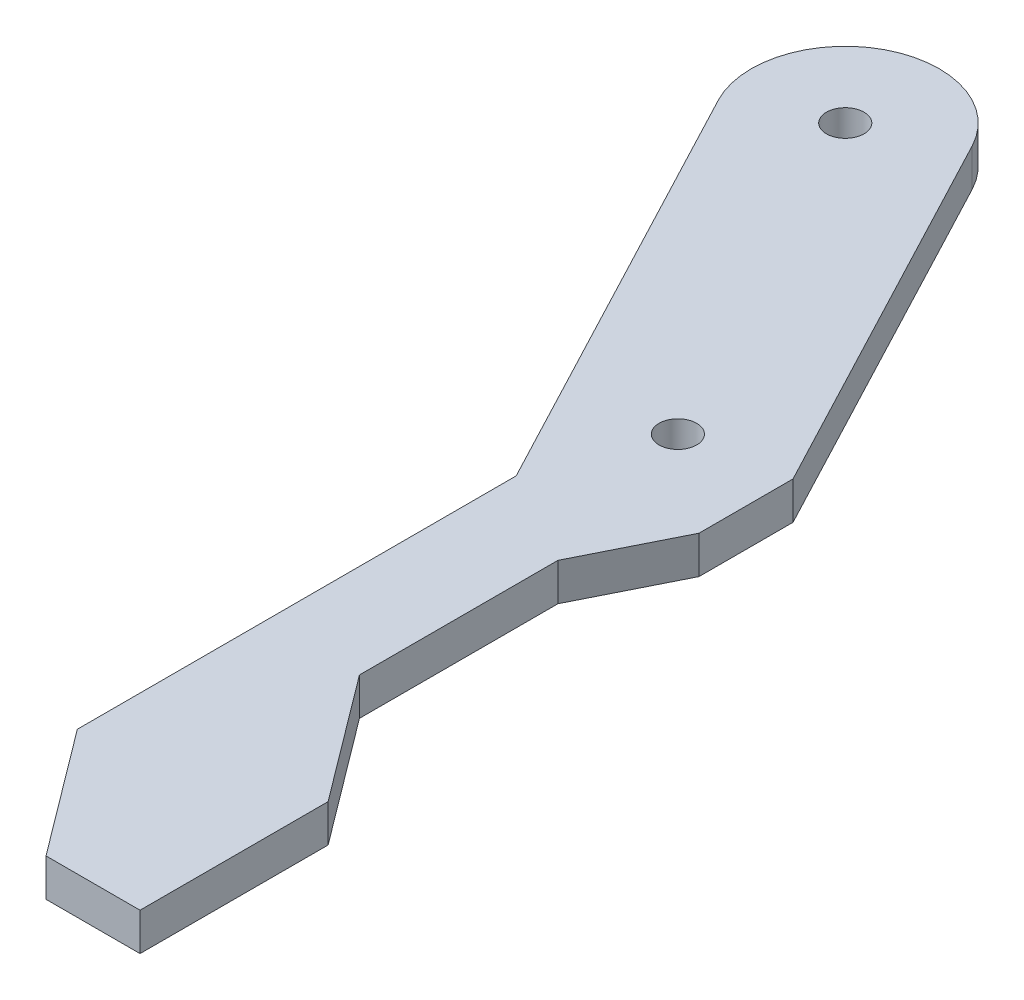
from build123d import *

# Parameters (mm, degrees)
CROQUIS1_R              = 1
SALIENTE_EXTRUIR1_DEPTH = 2


with BuildPart() as part:
    # Croquis1 → Saliente-Extruir1 (new body)
    with BuildSketch(Plane(origin=(0, 0, 0), x_dir=(1, 0, 0), z_dir=(0, 1, 0))):
        with BuildLine():
            Line((-1.930199007, 22.227708448), (9.995007766, -0.44472952))
            Line((9.995007766, -0.44472952), (9.995007766, -23.778062853))
            Line((9.995007766, -23.778062853), (14.995007766, -30.44472952))
            Line((14.995007766, -30.44472952), (19.995007766, -30.44472952))
            Line((19.995007766, -30.44472952), (19.995007766, -20.44472952))
            Line((19.995007766, -20.44472952), (14.995007766, -13.778062853))
            Line((14.995007766, -13.778062853), (14.995007766, -3.222172626))
            Line((14.995007766, -3.222172626), (17.495007766, 1.777827374))
            Line((17.495007766, 1.777827374), (17.495007766, 6.777827374))
            Line((17.495007766, 6.777827374), (6.920214539, 26.882832512))
            ThreePointArc((6.920214539, 26.882832512), (0.167445734, 28.980477254), (-1.930199007, 22.227708448))
        make_face()
        with Locations((2.495007766, 24.55527048)):
            Circle(CROQUIS1_R, mode=Mode.SUBTRACT)
        with Locations((12.371532383, 5.777827374)):
            Circle(CROQUIS1_R, mode=Mode.SUBTRACT)
    extrude(amount=SALIENTE_EXTRUIR1_DEPTH)


solid = part.part
